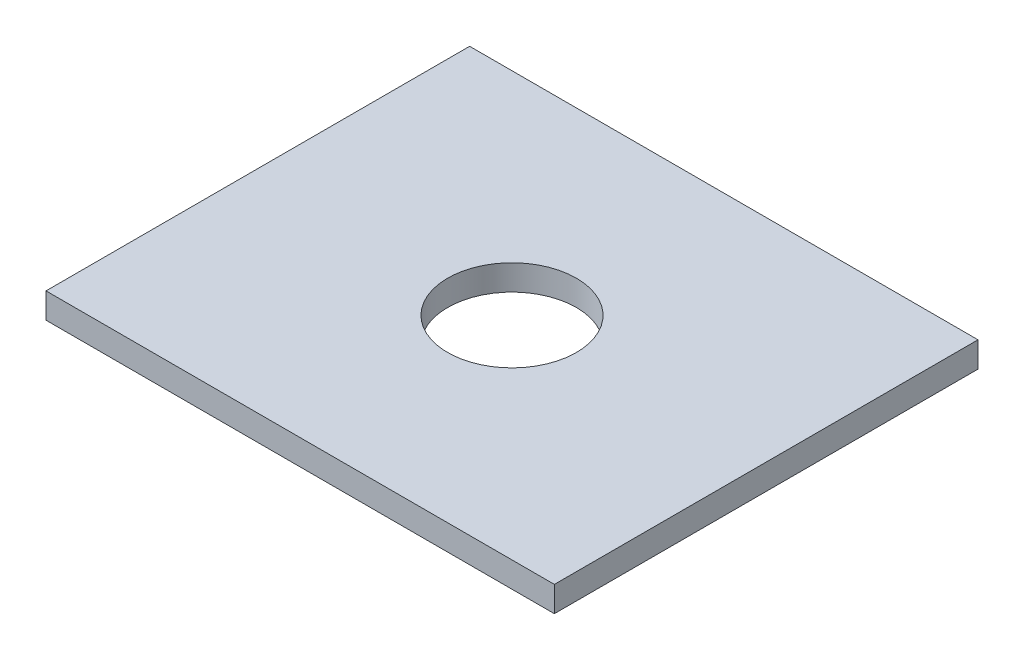
from build123d import *

# Parameters (mm, degrees)
SKETCH1_W           = 300
SKETCH1_H           = 250
BOSS_EXTRUDE1_DEPTH = 15
SKETCH3_R           = 38
CUT_EXTRUDE1_DEPTH  = 15


with BuildPart() as part:
    # Sketch1 → Boss-Extrude1 (new body)
    with BuildSketch(Plane(origin=(0, 0, 0), x_dir=(1, 0, 0), z_dir=(0, 1, 0))):
        Rectangle(SKETCH1_W, SKETCH1_H)
    extrude(amount=-BOSS_EXTRUDE1_DEPTH)

    # Sketch3 → Cut-Extrude1 (cut)
    with BuildSketch(Plane(origin=(0, -15, 0), x_dir=(-1, 0, 0), z_dir=(0, -1, 0))):
        Circle(SKETCH3_R)
    extrude(amount=-CUT_EXTRUDE1_DEPTH, mode=Mode.SUBTRACT)


solid = part.part
